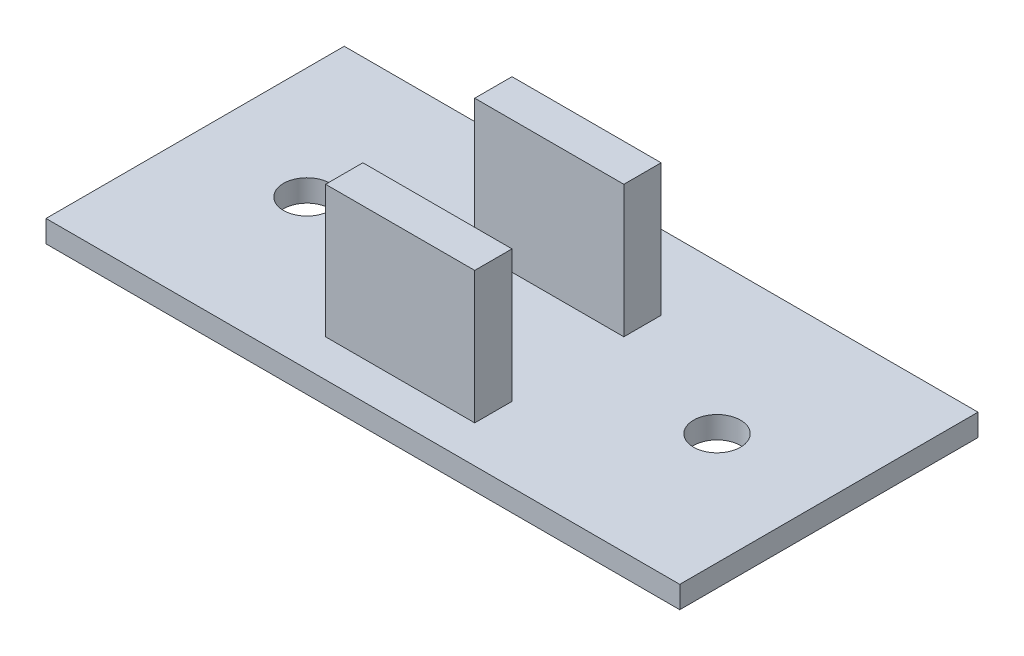
from build123d import *

# Parameters (mm, degrees)
SKETCH1_W             = 43.18
SKETCH1_H             = 20.32
SKETCH1_R             = 1.6
BOSS_EXTRUDE1_DEPTH   = 1.5
SKETCH2_W             = 10.16
SKETCH2_H             = 2.54
BOSS_EXTRUDE2_DEPTH   = 9
BOSS_EXTRUDE2_2_DEPTH = 9


with BuildPart() as part:
    # Sketch1 → Boss-Extrude1 (new body)
    with BuildSketch(Plane(origin=(0, 0, 0), x_dir=(1, 0, 0), z_dir=(0, 1, 0))):
        with Locations((21.59, 10.16)):
            Rectangle(SKETCH1_W, SKETCH1_H)
        with Locations((7.62, 10.16)):
            Circle(SKETCH1_R, mode=Mode.SUBTRACT)
        with Locations((35.56, 10.16)):
            Circle(SKETCH1_R, mode=Mode.SUBTRACT)
    extrude(amount=BOSS_EXTRUDE1_DEPTH)


with BuildPart() as body_2:
    # Sketch2 → Boss-Extrude2 (new body)
    with BuildSketch(Plane(origin=(0, 1.5, 0), x_dir=(1, 0, 0), z_dir=(0, 1, 0))):
        with Locations((21.59, 3.81)):
            Rectangle(SKETCH2_W, SKETCH2_H)
    extrude(amount=BOSS_EXTRUDE2_DEPTH)


with BuildPart() as body_3:
    # Sketch2 → Boss-Extrude2 2 (new body)
    with BuildSketch(Plane(origin=(0, 1.5, 0), x_dir=(1, 0, 0), z_dir=(0, 1, 0))):
        with Locations((21.59, 13.97)):
            Rectangle(SKETCH2_W, SKETCH2_H)
    extrude(amount=BOSS_EXTRUDE2_2_DEPTH)


solid = Compound([part.part, body_2.part, body_3.part])
